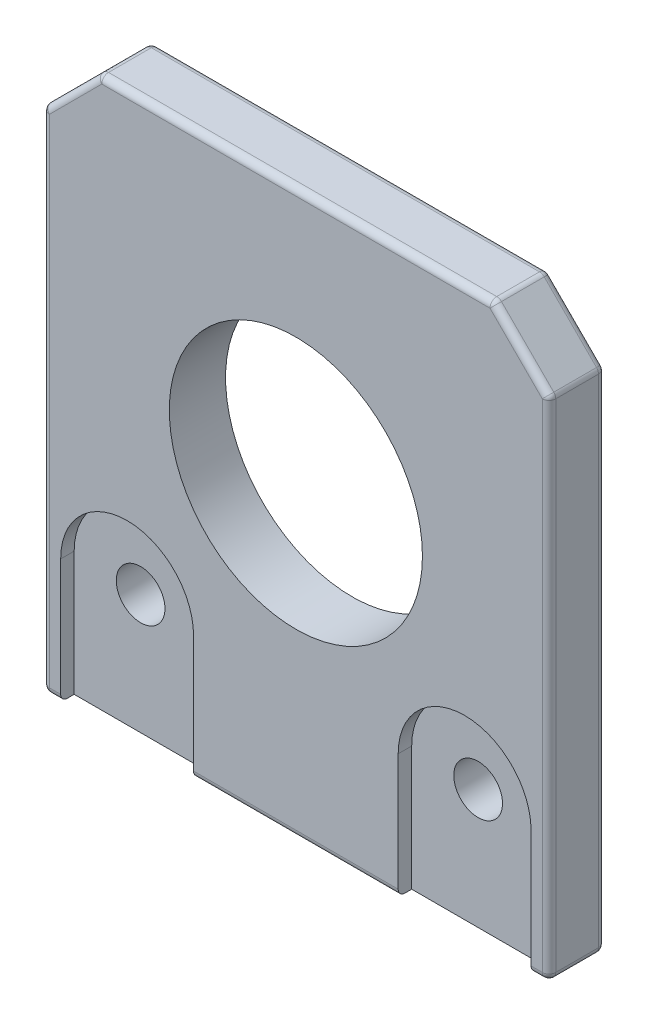
from build123d import *

# Parameters (mm, degrees)
SKETCH2_W            = 57.15
SKETCH2_H            = 6.35
BOSS_EXTRUDE1_DEPTH  = 63.5
SKETCH3_R            = 14.2875
CUT_EXTRUDE1_DEPTH   = 70.922121857
CHAMFER1_SIZE        = 6.35
M5_CLEARANCE_HOLE1_D = 5.5
FILLET1_R            = 0.762
CUT_EXTRUDE4_DEPTH   = 1.524


with BuildPart() as part:
    # Sketch2 → Boss-Extrude1 (new body)
    with BuildSketch(Plane(origin=(0, 0, 0), x_dir=(1, 0, 0), z_dir=(0, 1, 0))):
        Rectangle(SKETCH2_W, SKETCH2_H)
    extrude(amount=-BOSS_EXTRUDE1_DEPTH)

    # Sketch3 → Cut-Extrude1 (cut, through all)
    with BuildSketch(Plane.XY.offset(3.175)):
        with Locations((0, -28.8150046)):
            Circle(SKETCH3_R)
    extrude(amount=-CUT_EXTRUDE1_DEPTH, mode=Mode.SUBTRACT)

    # Chamfer1
    chamfer1_edges = [part.edges().sort_by_distance(p)[0] for p in [
        (-28.575, 0, 0),
        (28.575, 0, 0),
    ]]
    chamfer(chamfer1_edges, length=CHAMFER1_SIZE)

    # M5 Clearance Hole1 (through all)
    with Locations(Plane.XY.offset(3.175)):
        with Locations((-19.05, -50.000003124), (19.05, -50.000003124)):
            Hole(M5_CLEARANCE_HOLE1_D / 2)

    # Fillet1
    fillet1_edges = [part.edges().sort_by_distance(p)[0] for p in [
        (0, -63.5, 3.175),
        (0, -63.5, -3.175),
        (28.575, -63.5, 0),
        (28.575, -34.925, 3.175),
        (28.575, -34.925, -3.175),
        (-28.575, -63.5, 0),
        (-28.575, -34.925, -3.175),
        (-28.575, -34.925, 3.175),
        (-25.4, -3.175, 3.175),
        (-28.575, -6.35, 0),
        (-25.4, -3.175, -3.175),
        (0, 0, 3.175),
        (-22.225, 0, 0),
        (0, 0, -3.175),
        (22.225, 0, 0),
        (25.4, -3.175, -3.175),
        (28.575, -6.35, 0),
        (25.4, -3.175, 3.175),
    ]]
    fillet(fillet1_edges, radius=FILLET1_R)

    # Sketch8 → Cut-Extrude4 (cut)
    with BuildSketch(Plane.XY.offset(3.175)):
        with BuildLine():
            Line((11.55, -63.5), (11.55, -49.5))
            ThreePointArc((11.55, -49.5), (19.05, -42), (26.55, -49.5))
            Line((26.55, -49.5), (26.55, -63.5))
            Line((26.55, -63.5), (11.55, -63.5))
        make_face()
    cut_extrude4 = extrude(amount=-CUT_EXTRUDE4_DEPTH, mode=Mode.SUBTRACT)

    # Mirror1: Cut-Extrude4 across plane
    add(cut_extrude4.mirror(Plane(origin=(0, 0, 0), x_dir=(0, 0, 1), z_dir=(1, 0, 0))), mode=Mode.SUBTRACT)


solid = part.part
